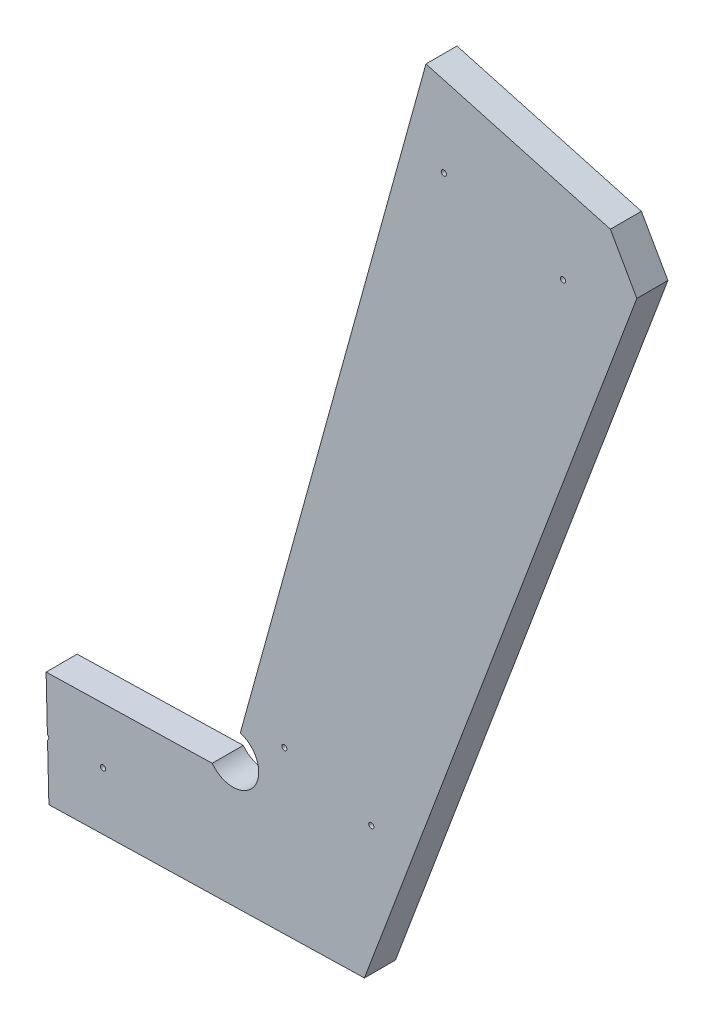
from build123d import *

# Parameters (mm, degrees)
BOSS_EXTRUDE1_DEPTH = 19.05
HOLE3_D             = 3.175
HOLE3_DEPTH         = 38.1
HOLE3_CSINK_D       = 10.16
HOLE3_CSINK_ANGLE   = 82
HOLE3_TIP           = 0.953866233


with BuildPart() as part:
    # Sketch1 → Boss-Extrude1 (new body)
    with BuildSketch(Plane.XY):
        with BuildLine():
            Line((-85.160107618, -534.890646796), (-83.459553046, -604.536867316))
            Line((-83.459553046, -604.536867316), (110.157739028, -599.809306096))
            Line((110.157739028, -599.809306096), (277.322178144, -155.105796357))
            Line((277.322178144, -155.105796357), (261.069157544, -126.448741632))
            Line((261.069157544, -126.448741632), (147.913577672, -95.195494697))
            Line((147.913577672, -95.195494697), (33.997973007, -507.638602732))
            ThreePointArc((33.997973007, -507.638602732), (42.480806483, -531.913781646), (16.770796424, -532.401795806))
            Line((16.770796424, -532.401795806), (-85.160107618, -534.890646796))
        make_face()
    extrude(amount=BOSS_EXTRUDE1_DEPTH)

    # Hole3
    with Locations(Plane(origin=(281.377269282, -144.318135593, -19.05), x_dir=(-0.3518626346959965, -0.9360516472421764, 8.51430303154421e-15), z_dir=(0, 0, -1))):
        with Locations((46.221112845, 113.488854888), (39.39759596, 37.945520226), (412.28786892, 80.423559293), (407.308516105, 25.297013484), (513.561319184, 161.164706775), (597.46020397, 127.267357003), (610.543339245, 159.649253123), (694.322923815, 367.011001477), (526.644454459, 193.546602895), (610.424039029, 400.908351249)):
            CounterSinkHole(HOLE3_D / 2, HOLE3_CSINK_D / 2, depth=HOLE3_DEPTH, counter_sink_angle=HOLE3_CSINK_ANGLE)
            with Locations((0, 0, -(HOLE3_DEPTH + HOLE3_TIP / 2))):  # 118° drill point
                Cone(0, HOLE3_D / 2, HOLE3_TIP, mode=Mode.SUBTRACT)


solid = part.part
